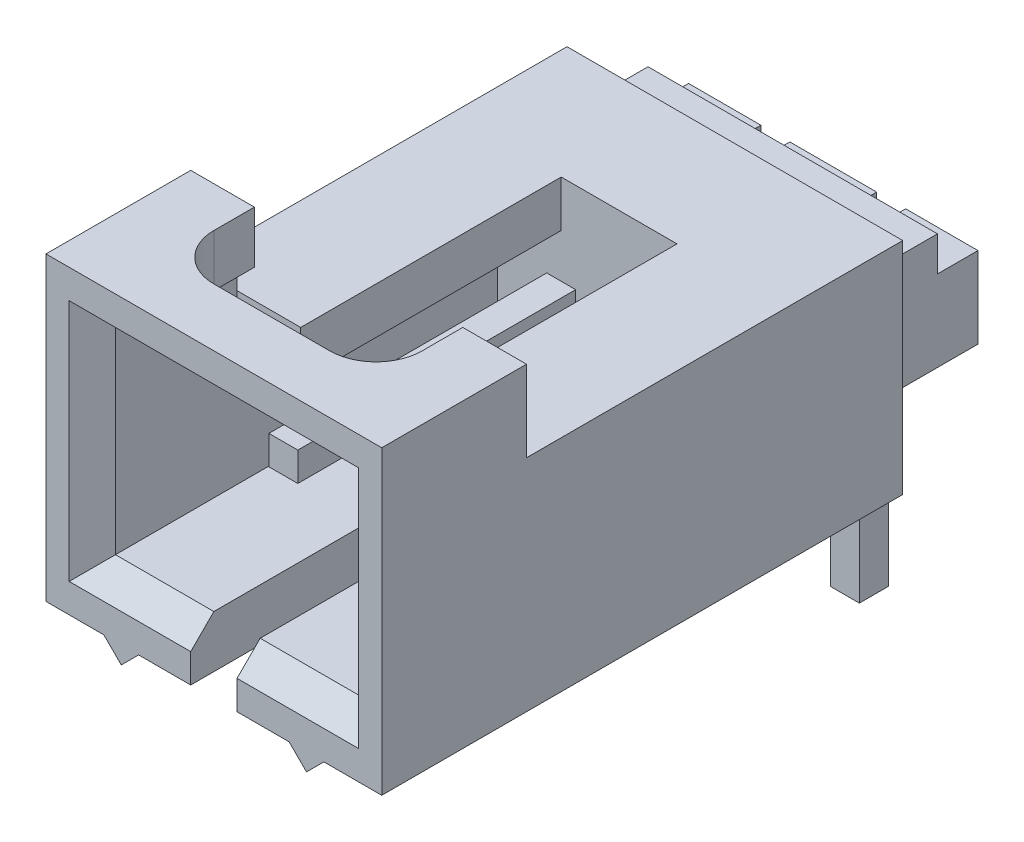
from build123d import *

# Parameters (mm, degrees)
BOSS_EXTRUDE1_DEPTH  = 8.255000001
CUT_EXTRUDE1_DEPTH   = 5.715
BOSS_EXTRUDE2_DEPTH  = 3.175
SKETCH4_W            = 4.572
SKETCH4_H            = 1.143
CUT_EXTRUDE2_DEPTH   = 1.905
SKETCH5_W            = 0.635
SKETCH5_H            = 0.635
BOSS_EXTRUDE3_DEPTH  = 6.096
SKETCH6_W            = 0.635
SKETCH6_H            = 0.635
BOSS_EXTRUDE4_DEPTH  = 6.096
SKETCH7_W            = 0.635
SKETCH7_H            = 1.0668
BOSS_EXTRUDE5_DEPTH  = 1.778
SKETCH8_W            = 0.635
SKETCH8_H            = 1.0668
BOSS_EXTRUDE6_DEPTH  = 1.778
SKETCH9_W            = 0.635
SKETCH9_H            = 0.635
BOSS_EXTRUDE7_DEPTH  = 5.207
SKETCH10_W           = 0.635
SKETCH10_H           = 0.635
BOSS_EXTRUDE8_DEPTH  = 5.207
BOSS_EXTRUDE9_DEPTH  = 1.27
SKETCH12_W           = 1.5875
SKETCH12_H           = 1.778
BOSS_EXTRUDE10_DEPTH = 0.889
SKETCH13_W           = 1.905
SKETCH13_H           = 1.778
BOSS_EXTRUDE11_DEPTH = 0.889
SKETCH14_W           = 1.5875
SKETCH14_H           = 1.778
BOSS_EXTRUDE12_DEPTH = 0.889
FILLET1_R            = 1.27
FILLET2_R            = 1.27
CHAMFER1_SIZE        = 0.508
CHAMFER2_SIZE        = 0.508
DRAFT1_ANGLE         = 45
CHAMFER3_SIZE        = 0.508
FILLET3_R            = 1.016


with BuildPart() as part:
    # Sketch1 → Boss-Extrude1 (new body)
    with BuildSketch(Plane.XY.offset(2.54)):
        Polygon((3.683, 2.286), (-3.683, 2.286), (-3.683, -2.54), (-2.413, -2.54), (-1.651, -3.302), (-1.651, -2.54), (1.651, -2.54), (1.651, -3.302), (2.413, -2.54), (3.683, -2.54), align=None)
    extrude(amount=-BOSS_EXTRUDE1_DEPTH)

    # Sketch2 → Cut-Extrude1 (cut)
    with BuildSketch(Plane.XY.offset(2.54)):
        Polygon((2.667, -1.397), (2.667, 1.27), (1.27, 1.27), (1.27, 2.286000001), (-1.270000001, 2.286000001), (-1.270000001, 1.27), (-2.667, 1.27), (-2.667, -1.397), (-0.508, -1.397), (-0.508, -2.54), (0.508, -2.54), (0.508, -1.397), align=None)
    extrude(amount=-CUT_EXTRUDE1_DEPTH, mode=Mode.SUBTRACT)

    # Sketch3 → Boss-Extrude2 (add)
    with BuildSketch(Plane.XY.offset(2.54)):
        Polygon((0.508, -1.397), (2.667, -1.397), (2.667, 2.921), (-2.667, 2.921), (-2.667, -1.397), (-0.508, -1.397), (-0.508, -2.54), (-1.651, -2.54), (-1.651, -3.302), (-2.413, -2.54), (-3.683, -2.54), (-3.683, 4.064), (3.683, 4.064), (3.683, -2.54), (2.413, -2.54), (1.651, -3.302), (1.651, -2.54), (0.508, -2.54), align=None)
    extrude(amount=BOSS_EXTRUDE2_DEPTH)

    # Sketch4 → Cut-Extrude2 (cut)
    with BuildSketch(Plane(origin=(0, 0, 2.54), x_dir=(-1, 0, 0), z_dir=(0, 0, -1))):
        with Locations((0, 3.4925)):
            Rectangle(SKETCH4_W, SKETCH4_H)
    extrude(amount=-CUT_EXTRUDE2_DEPTH, mode=Mode.SUBTRACT)

    # Sketch5 → Boss-Extrude3 (add)
    with BuildSketch(Plane.XY.offset(-3.175)):
        with Locations((-1.27, -0.0127)):
            Rectangle(SKETCH5_W, SKETCH5_H)
    extrude(amount=BOSS_EXTRUDE3_DEPTH)

    # Sketch6 → Boss-Extrude4 (add)
    with BuildSketch(Plane.XY.offset(-3.175)):
        with Locations((1.27, -0.0127)):
            Rectangle(SKETCH6_W, SKETCH6_H)
    extrude(amount=BOSS_EXTRUDE4_DEPTH)

    # Sketch7 → Boss-Extrude5 (add)
    with BuildSketch(Plane(origin=(0, 0, -5.715000001), x_dir=(-1, 0, 0), z_dir=(0, 0, -1))):
        with Locations((1.27, -0.4826)):
            Rectangle(SKETCH7_W, SKETCH7_H)
    extrude(amount=BOSS_EXTRUDE5_DEPTH)

    # Sketch8 → Boss-Extrude6 (add)
    with BuildSketch(Plane(origin=(0, 0, -5.715000001), x_dir=(-1, 0, 0), z_dir=(0, 0, -1))):
        with Locations((-1.27, -0.4826)):
            Rectangle(SKETCH8_W, SKETCH8_H)
    extrude(amount=BOSS_EXTRUDE6_DEPTH)

    # Sketch9 → Boss-Extrude7 (add)
    with BuildSketch(Plane.XZ.offset(1.016)):
        with Locations((-1.27, -7.1755)):
            Rectangle(SKETCH9_W, SKETCH9_H)
    extrude(amount=BOSS_EXTRUDE7_DEPTH)

    # Sketch10 → Boss-Extrude8 (add)
    with BuildSketch(Plane.XZ.offset(1.016)):
        with Locations((1.27, -7.1755)):
            Rectangle(SKETCH10_W, SKETCH10_H)
    extrude(amount=BOSS_EXTRUDE8_DEPTH)

    # Sketch11 → Boss-Extrude9 (add)
    with BuildSketch(Plane(origin=(0, 0, -6.985), x_dir=(-1, 0, 0), z_dir=(0, 0, -1))):
        Polygon((0.9525, 0.050800001), (1.5875, 0.050800001), (1.5875, -1.016), (3.175, -1.016), (3.175, 1.524), (-3.175, 1.524), (-3.175, -1.016), (-1.5875, -1.016), (-1.5875, 0.050800001), (-0.9525, 0.050800001), (-0.9525, -1.016), (0.9525, -1.016), align=None)
    extrude(amount=-BOSS_EXTRUDE9_DEPTH)

    # Sketch12 → Boss-Extrude10 (add)
    with BuildSketch(Plane(origin=(0, 0, -7.874), x_dir=(-1, 0, 0), z_dir=(0, 0, -1))):
        with Locations((2.38125, -0.127)):
            Rectangle(SKETCH12_W, SKETCH12_H)
    extrude(amount=-BOSS_EXTRUDE10_DEPTH)

    # Sketch13 → Boss-Extrude11 (add)
    with BuildSketch(Plane(origin=(0, 0, -7.874), x_dir=(-1, 0, 0), z_dir=(0, 0, -1))):
        with Locations((0, -0.127)):
            Rectangle(SKETCH13_W, SKETCH13_H)
    extrude(amount=-BOSS_EXTRUDE11_DEPTH)

    # Sketch14 → Boss-Extrude12 (add)
    with BuildSketch(Plane(origin=(0, 0, -7.874), x_dir=(-1, 0, 0), z_dir=(0, 0, -1))):
        with Locations((-2.38125, -0.127)):
            Rectangle(SKETCH14_W, SKETCH14_H)
    extrude(amount=-BOSS_EXTRUDE12_DEPTH)

    # Fillet1
    # the kernel refuses this fillet: 1.27 mm, written as the material it takes off along each edge
    with BuildSketch(Plane(origin=(1.5875, 0.0508, -7.493), x_dir=(0, -1, 0), z_dir=(-1, 0, 0))) as fillet1_piece_1:
        with BuildLine():
            CenterArc((1.016, 1.27), FILLET1_R, 216.869897624, 53.130102376)
            Line((0, 0.508), (0, 0))
            Line((0, 0), (1.016, 0))
        make_face()
    extrude(amount=0.635, mode=Mode.SUBTRACT)

    # Fillet2
    # the kernel refuses this fillet: 1.27 mm, written as the material it takes off along each edge
    with BuildSketch(Plane(origin=(1.5875, 0.0508, -7.493), x_dir=(0, -1, 0), z_dir=(-1, 0, 0))) as fillet2_piece_1_section:
        with BuildLine():
            CenterArc((1.016, 1.27), FILLET2_R, 216.869897624, 53.130102376)
            Line((0, 0.508), (-0.02032, 0.49276))
            ThreePointArc((-0.02032, 0.49276), (-0.0254, 0.254), (-0.0254, 0))
            Line((-0.0254, 0), (0, -0.0254))
            Line((0, -0.0254), (1.016, -0.0254))
            Line((1.016, -0.0254), (1.016, 0))
        make_face()
    fillet2_piece_1 = extrude(amount=3.175, mode=Mode.PRIVATE)
    fillet2_piece_1 = split(fillet2_piece_1, bisect_by=Plane(origin=(0.9525, -0.210671932, -7.36296659), z_dir=(1, 0, 0)), keep=Keep.TOP, mode=Mode.PRIVATE)
    add(fillet2_piece_1, mode=Mode.SUBTRACT)
    with BuildSketch(Plane(origin=(-0.9525, 0.0508, -7.493), x_dir=(0, -1, 0), z_dir=(-1, 0, 0))) as fillet2_piece_2:
        with BuildLine():
            CenterArc((1.016, 1.27), FILLET2_R, 216.869897624, 53.130102376)
            Line((0, 0.508), (-0.02032, 0.49276))
            ThreePointArc((-0.02032, 0.49276), (-0.0254, 0.254), (-0.0254, 0))
            Line((-0.0254, 0), (0, -0.0254))
            Line((0, -0.0254), (1.016, -0.0254))
            Line((1.016, -0.0254), (1.016, 0))
        make_face()
    extrude(amount=0.635, mode=Mode.SUBTRACT)

    # Chamfer1
    chamfer1_edges = [part.edges().sort_by_distance(p)[0] for p in [
        (1.9685, 1.27, 2.54),
    ]]
    chamfer(chamfer1_edges, length=CHAMFER1_SIZE)

    # Chamfer2
    chamfer2_edges = [part.edges().sort_by_distance(p)[0] for p in [
        (-1.9685, 1.27, 2.54),
    ]]
    chamfer(chamfer2_edges, length=CHAMFER2_SIZE)

    # Draft1
    draft1_faces = [part.faces().sort_by_distance(p)[0] for p in [
        (1.651, -2.921, 0),
        (-1.651, -2.921, 0),
    ]]
    draft(draft1_faces, Plane(origin=(-1.651, -2.54, -5.715000001), x_dir=(0, 0, -1), z_dir=(0, -1, 0)), DRAFT1_ANGLE)

    # Chamfer3
    chamfer3_edges = [part.edges().sort_by_distance(p)[0] for p in [
        (-1.5875, -1.397, 5.715),
        (-2.667, 0.762, 5.715),
        (0, 2.921, 5.715),
        (2.667, 0.762, 5.715),
        (1.5875, -1.397, 5.715),
    ]]
    chamfer(chamfer3_edges, length=CHAMFER3_SIZE)

    # Fillet3
    fillet3_edges = [part.edges().sort_by_distance(p)[0] for p in [
        (-2.286, 3.4925, 4.445),
        (2.286, 3.4925, 4.445),
    ]]
    fillet(fillet3_edges, radius=FILLET3_R)


solid = part.part
